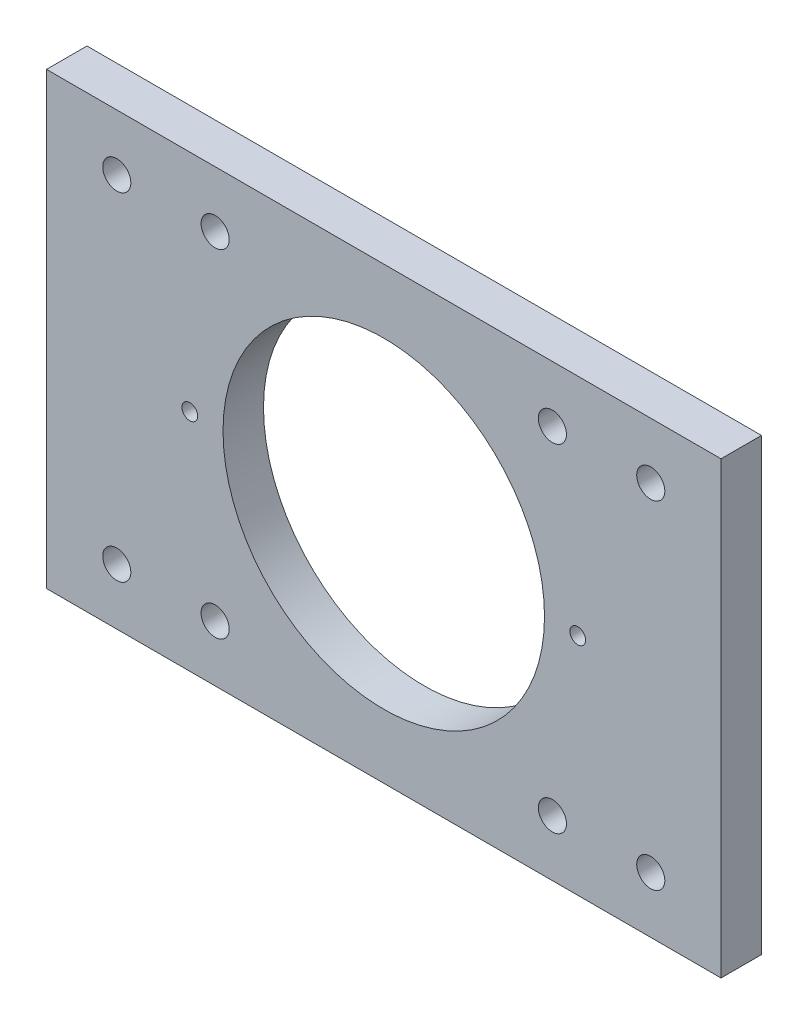
from build123d import *

# Parameters (mm, degrees)
SKETCH1_W               = 76.2
SKETCH1_H               = 50.8
BOSS_EXTRUDE1_DEPTH     = 4.572
CAVITY5_OUTLINE_R       = 18.161
CAVITY5_OUTLINE_R_2     = 0.889
CAVITY5_DEPTH           = 4.572
SKETCH3_R               = 1.5875
CUT_EXTRUDE1_DEPTH      = 92.695055396
MIRROR2_COPY_1_SKETCH_R = 1.5875
MIRROR2_COPY_1_DEPTH    = 92.695055396
SKETCH4_R               = 1.5875
CUT_EXTRUDE2_DEPTH      = 92.695055396


# Read off the part's stored shape, not the designer's step: Cavity5
with BuildPart() as part:
    # Sketch1 → Boss-Extrude1 (new body)
    with BuildSketch(Plane.XY):
        with Locations((38.1, 25.4)):
            Rectangle(SKETCH1_W, SKETCH1_H)
    extrude(amount=BOSS_EXTRUDE1_DEPTH)

    # Cavity5 outline → Cavity5 (cut)
    with BuildSketch(Plane.XY):
        with Locations((38.1, 25.4)):
            Circle(CAVITY5_OUTLINE_R)
        with Locations((16.188175065, 25.4)):
            Circle(CAVITY5_OUTLINE_R_2)
        with Locations((60.011824935, 25.4)):
            Circle(CAVITY5_OUTLINE_R_2)
    extrude(amount=CAVITY5_DEPTH, mode=Mode.SUBTRACT)

    # Sketch3 → Cut-Extrude1 (cut, through all)
    with BuildSketch(Plane(origin=(0, 0, 0), x_dir=(-1, 0, 0), z_dir=(0, 0, -1))):
        with Locations((-68.2625, 44.45)):
            Circle(SKETCH3_R)
    cut_extrude1 = extrude(amount=-CUT_EXTRUDE1_DEPTH, mode=Mode.SUBTRACT)

    # Mirror1: Cut-Extrude1 across plane
    add(cut_extrude1.mirror(Plane(origin=(38.1, 0, 0), x_dir=(0, 0, 1), z_dir=(1, 0, 0))), mode=Mode.SUBTRACT)

    # Mirror2: Cut-Extrude1 across plane
    add(cut_extrude1.mirror(Plane.ZX.offset(25.4)), mode=Mode.SUBTRACT)

    # Mirror2 copy 1 sketch → Mirror2 copy 1 (cut, through all)
    with BuildSketch(Plane(origin=(76.2, 50.8, 0), x_dir=(1, 0, 0), z_dir=(0, 0, -1))):
        with Locations((-68.2625, 44.45)):
            Circle(MIRROR2_COPY_1_SKETCH_R)
    extrude(amount=-MIRROR2_COPY_1_DEPTH, mode=Mode.SUBTRACT)

    # Sketch4 → Cut-Extrude2 (cut, through all)
    with BuildSketch(Plane(origin=(0, 0, 0), x_dir=(-1, 0, 0), z_dir=(0, 0, -1))):
        with Locations((-19.05, 44.45)):
            Circle(SKETCH4_R)
        with Locations((-57.15, 44.45)):
            Circle(SKETCH4_R)
        with Locations((-57.15, 6.35)):
            Circle(SKETCH4_R)
        with Locations((-19.05, 6.35)):
            Circle(SKETCH4_R)
    extrude(amount=-CUT_EXTRUDE2_DEPTH, mode=Mode.SUBTRACT)


solid = part.part
